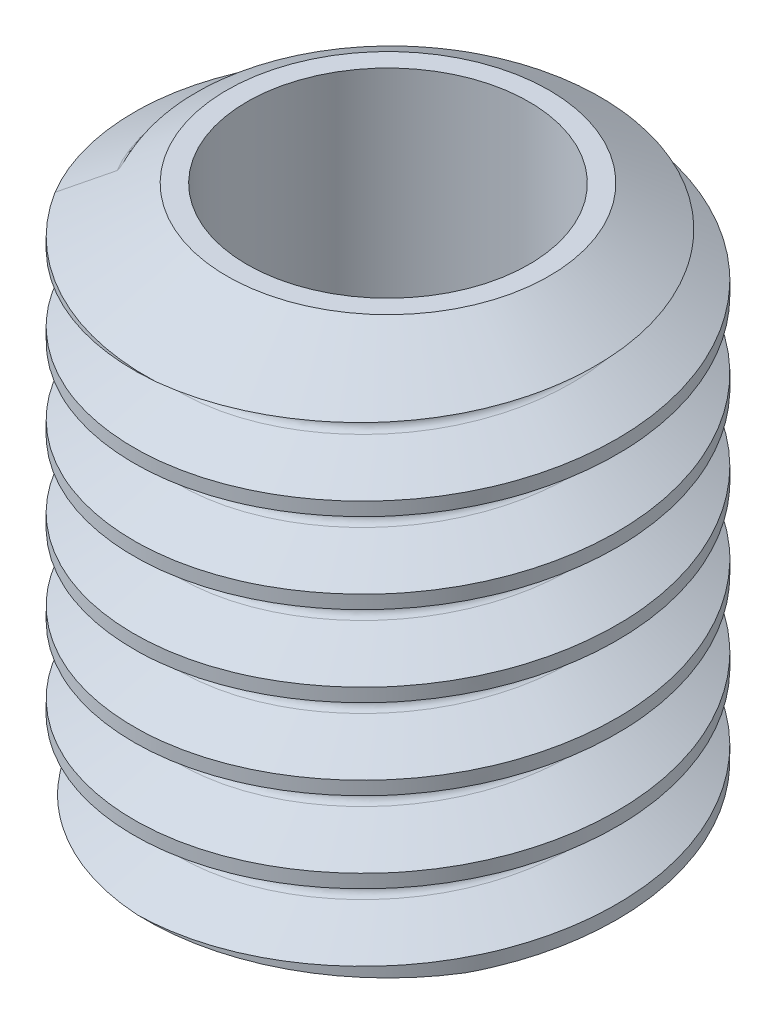
from build123d import *

# Parameters (mm, degrees)
SKETCH1_R           = 3
BOSS_EXTRUDE1_DEPTH = 7
CUT_SWEEP1_PITCH    = 1
SKETCH5_R           = 1.75
CUT_EXTRUDE2_DEPTH  = 9.185352945


with BuildPart() as part:
    # Sketch1 → Boss-Extrude1 (new body)
    with BuildSketch(Plane(origin=(0, 0, 0), x_dir=(1, 0, 0), z_dir=(0, 1, 0))):
        with Locations(Location((0, 0, 0), (0, 0, 270))):
            Circle(SKETCH1_R)
    extrude(amount=BOSS_EXTRUDE1_DEPTH)

    # Cut-Sweep1: the profile of Sketch3 profile screwed along a right-hand helix of 9 turns, 8 arcs to a turn; built about Z, then put on its axis
    cut_sweep1_z = Axis((0, 0, 0), (0, 0, 1))
    cut_sweep1_corners = [(2.440626588, 0, -0.09375), (3.0003, 0, -0.416877595), (3.0003, 0, 0.416877595), (2.440626588, 0, 0.09375), (2.3865, 0, 0)]
    with BuildLine(mode=Mode.PRIVATE) as cut_sweep1_profile:
        Line(cut_sweep1_corners[0], cut_sweep1_corners[1])
        Line(cut_sweep1_corners[1], cut_sweep1_corners[2])
        Line(cut_sweep1_corners[2], cut_sweep1_corners[3])
        ThreePointArc((2.440626588, 0, 0.09375), (2.401003175, 0, 0.054126588), (2.3865, 0, 0))
        ThreePointArc((2.3865, 0, 0), (2.401003175, 0, -0.054126588), (2.440626588, 0, -0.09375))
    cut_sweep1_cap = Face(cut_sweep1_profile.wire())
    cut_sweep1_arcs = [((2.440626588, 0, 0.09375), (2.3865, 0, 0.0625), (2.3865, 0, 0), (1, 0.8660254037844406, 1)), ((2.3865, 0, 0), (2.3865, 0, -0.0625), (2.440626588, 0, -0.09375), (1, 0.8660254037844406, 1))]  # start, shoulder, end, weights
    cut_sweep1_turn_angles = [0, 22.5, 45, 67.5, 90, 112.5, 135, 157.5, 180, 202.5, 225, 247.5, 270, 292.5, 315, 337.5, 360]
    cut_sweep1_turn_weights = [1, 0.9238795325112867, 1, 0.9238795325112867, 1, 0.9238795325112867, 1, 0.9238795325112867, 1, 0.9238795325112867, 1, 0.9238795325112867, 1, 0.9238795325112867, 1, 0.9238795325112867, 1]
    cut_sweep1_turn_rails = [Edge.make_bspline([Vector(p[0], p[1], 0).rotate(cut_sweep1_z, cut_sweep1_turn_angles[k]) / cut_sweep1_turn_weights[k] + Vector(0, 0, p[2] + CUT_SWEEP1_PITCH * cut_sweep1_turn_angles[k] / 360) for k in range(17)], [0, 0, 0, 1, 1, 2, 2, 3, 3, 4, 4, 5, 5, 6, 6, 7, 7, 8, 8, 8], 2, cut_sweep1_turn_weights) for p in cut_sweep1_corners]
    cut_sweep1_turn_sides = [*[Face.make_surface_from_curves(cut_sweep1_turn_rails[p[0]], cut_sweep1_turn_rails[p[1]]) for p in [(0, 1), (1, 2), (2, 3)]], *[Face.make_bezier_surface([[Vector(p[j][0], p[j][1], 0).rotate(cut_sweep1_z, cut_sweep1_turn_angles[2 * i + k]) / cut_sweep1_turn_weights[2 * i + k] + Vector(0, 0, p[j][2] + CUT_SWEEP1_PITCH * cut_sweep1_turn_angles[2 * i + k] / 360) for k in range(3)] for j in range(3)], [[p[3][j] * cut_sweep1_turn_weights[2 * i + k] for k in range(3)] for j in range(3)]) for p in cut_sweep1_arcs for i in range(8)]]
    cut_sweep1 = Plane(origin=(0, 8, 0), x_dir=(0, 0, 1), z_dir=(0, -1, 0)) * Solid(Shell([*[p.moved(Location((0, 0, CUT_SWEEP1_PITCH * i))) for i in range(9) for p in cut_sweep1_turn_sides], cut_sweep1_cap, cut_sweep1_cap.rotate(cut_sweep1_z, 3240).moved(Location((0, 0, CUT_SWEEP1_PITCH * 3240 / 360)))]))
    add(cut_sweep1, mode=Mode.SUBTRACT)

    # Sketch5 → Cut-Extrude2 (cut, through all)
    with BuildSketch(Plane(origin=(0, 0, 0), x_dir=(1, 0, 0), z_dir=(0, 1, 0))):
        with Locations(Location((0, 0, 0), (0, 0, 270))):
            Circle(SKETCH5_R)
    extrude(amount=CUT_EXTRUDE2_DEPTH, mode=Mode.SUBTRACT)

    # Sketch4 → Cut-Revolve2 (revolve, cut)
    with BuildSketch(Plane(origin=(0, 0, 0), x_dir=(0, 0, -1), z_dir=(1, 0, 0))):
        Polygon((3, 7), (2, 7), (3, 6.422649731), align=None)
        Polygon((3, 0), (2, 0), (3, 0.577350269), align=None)
    revolve(axis=Axis((0, 0, 0), (0, 1, 0)), mode=Mode.SUBTRACT)


solid = part.part
